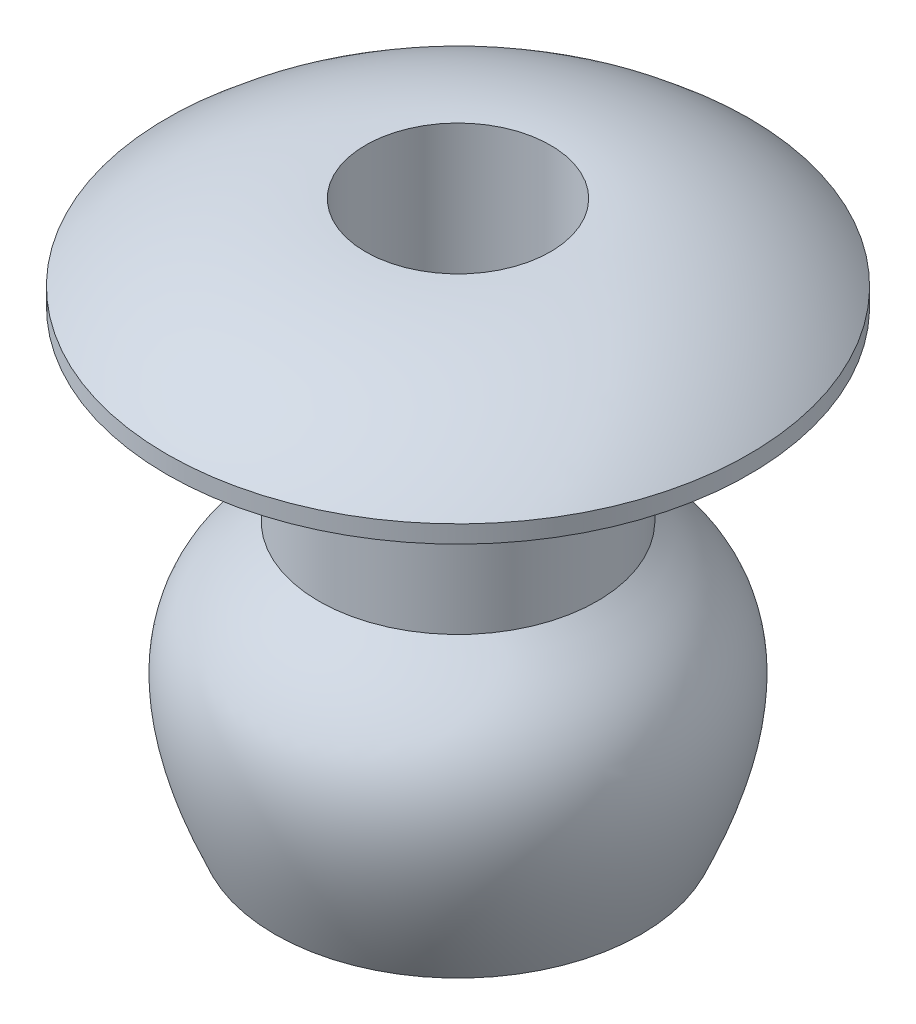
from build123d import *


with BuildPart() as part:
    # Sketch1 → Revolve1 (revolve)
    with BuildSketch(Plane(origin=(0, 0, 0), x_dir=(0, 0, -1), z_dir=(1, 0, 0))):
        with BuildLine():
            Line((-2.38125, 0), (-2.38125, -3.175))
            add(Edge.make_bspline(
                [(-3.13125, -7.735), (-4.481572132, -4.69339441), (-3.285209116, -3.987769359), (-2.38125, -3.175)],
                knots=[0, 0, 0, 0, 0.915818095, 0.915818095, 0.915818095, 0.915818095], degree=3))
            Line((-3.13125, -7.735), (-2.40976315, -7.735))
            ThreePointArc((-2.40976315, -7.735), (-2.325925169, -7.689508651), (-2.318365246, -7.59442386))
            Line((-2.318365246, -7.59442386), (-2.400066766, -7.410390883))
            add(Edge.make_bspline(
                [(-2.400066766, -7.410390883), (-2.473481138, -7.24502474), (-2.618671482, -6.893141661), (-2.815459664, -6.312909566), (-2.942253182, -5.717677034), (-2.94337461, -5.221055296), (-2.834112517, -4.774968107), (-2.602438756, -4.449638795), (-2.212365795, -4.086777888), (-1.962545412, -3.874353641), (-1.846366913, -3.769895018)],
                knots=[0, 0, 0, 0, 0.057238631, 0.114477262, 0.228954524, 0.343431786, 0.457909047, 0.686863571, 0.801340833, 0.915818095, 0.915818095, 0.915818095, 0.915818095], degree=3))
            Line((-1.846366913, -3.769895018), (-1.58125, -3.531522619))
            Line((-1.58125, -3.531522619), (-1.58125, 1.6002))
            ThreePointArc((-1.58125, 1.6002), (-3.399982262, 1.264045733), (-4.9784, 0.3))
            Line((-4.9784, 0.3), (-4.9784, 0))
            Line((-4.9784, 0), (-2.38125, 0))
        make_face()
    revolve(axis=Axis((0, 0, 0), (0, -1, 0)))


solid = part.part
